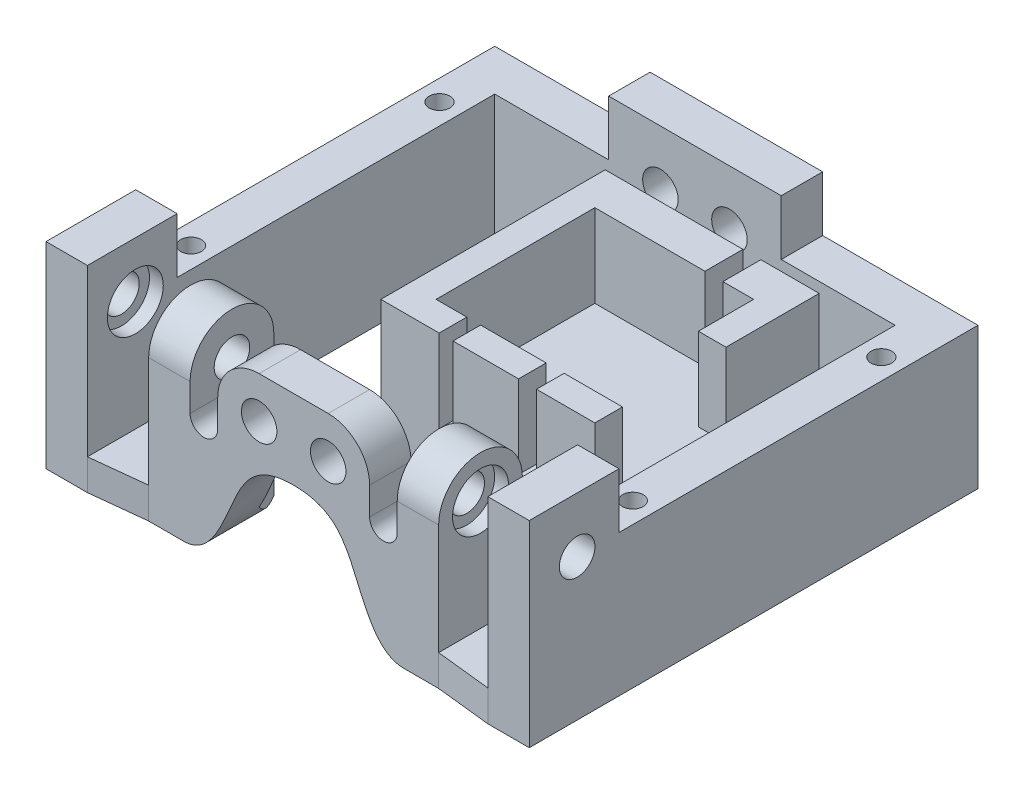
from build123d import *
from build123d.topology import SkipClean

# Parameters (mm, degrees)
BOSS_EXTRUDE1_DEPTH   = 20.5
SKETCH2_W             = 25
SKETCH2_H             = 6
BOSS_EXTRUDE2_DEPTH   = 8
CUT_EXTRUDE1_REACH    = 78.618
SKETCH3_R             = 2.575
SKETCH4_R             = 4.05
CUT_EXTRUDE2_DEPTH    = 2
SKETCH5_W             = 23
SKETCH5_H             = 23
BOSS_EXTRUDE3_DEPTH   = 7
SKETCH16_W            = 31
SKETCH16_H            = 32.5
SKETCH16_W_2          = 23
SKETCH16_H_2          = 23
BOSS_EXTRUDE6_DEPTH   = 19
SKETCH18_W            = 2.6
SKETCH18_H            = 5.5
SKETCH18_H_2          = 4
SKETCH18_W_2          = 2
SKETCH18_W_3          = 4
SKETCH18_H_3          = 15
CUT_EXTRUDE10_DEPTH   = 12
SKETCH8_W             = 6
SKETCH8_H             = 13
BOSS_EXTRUDE4_DEPTH   = 8
CUT_EXTRUDE_X_REACH   = 81.853
SKETCH7_R             = 2.575
SKETCH9_R             = 4.05
CUT_EXTRUDE4_DEPTH    = 2
SKETCH10_W            = 29
SKETCH10_H            = 13
BOSS_EXTRUDE5_DEPTH   = 28.5
SKETCH12_W            = 8
SKETCH12_H            = 13
SKETCH12_W_2          = 15
CUT_EXTRUDE6_DEPTH    = 24
CUT_EXTRUDE7_REACH    = 69.915
SKETCH13_R            = 2.575
CUT_EXTRUDE8_START    = -2
SKETCH14_R            = 4.05
CUT_EXTRUDE8_DEPTH    = 2
CUT_EXTRUDE9_REACH    = 69.915
SKETCH23_W            = 11
SKETCH23_H            = 6
BOSS_EXTRUDE8_DEPTH   = 22
CUT_EXTRUDE12_REACH   = 67.949
SKETCH21_R            = 2.575
SKETCH22_R            = 4.05
CUT_EXTRUDE13_DEPTH   = 2
CUT_EXTRUDE14_REACH   = 78.618
BOSS_EXTRUDE9_REACH   = 77.878
CUT_EXTRUDE15_REACH   = 56.621
CUT_EXTRUDE16_REACH   = 78.618
CUT_EXTRUDE18_REACH   = 55.453
MIRROR1_START         = 19.5
MIRROR1_OUTLINE_R     = 4.05
MIRROR1_DEPTH         = 13
MIRROR1_START_2       = 27.626981996
MIRROR1_2_OUTLINE_R   = 4.05
MIRROR1_2_OUTLINE_R_2 = 2.575
MIRROR1_2_DEPTH       = 4
MIRROR1_START_3       = -11
MIRROR1_3_OUTLINE_W   = 6
MIRROR1_3_OUTLINE_H   = 0.873018004
MIRROR1_3_DEPTH       = 11
MIRROR1_START_4       = -35
MIRROR1_4_OUTLINE_R   = 2.575
MIRROR1_4_DEPTH       = 20
MIRROR1_START_5       = -31
MIRROR1_5_OUTLINE_R   = 4.05
MIRROR1_5_OUTLINE_R_2 = 2.575
MIRROR1_5_DEPTH       = 12
MIRROR1_START_6       = -21
MIRROR1_6_DEPTH       = 6
MIRROR1_START_7       = -19
MIRROR1_7_DEPTH       = 4
MIRROR1_8_DEPTH       = 21
SKETCH33_R            = 1.5
CUT_EXTRUDE19_DEPTH   = 10


with BuildPart() as part:
    # Sketch1 → Boss-Extrude1 (new body)
    with BuildSketch(Plane(origin=(0, 0, 0), x_dir=(1, 0, 0), z_dir=(0, 1, 0))):
        Polygon((-29, 26.5), (-29, -32.5), (-35, -32.5), (-35, 32.5), (35, 32.5), (35, -32.5), (29, -32.5), (29, 26.5), align=None)
    extrude(amount=-BOSS_EXTRUDE1_DEPTH)

    # Sketch2 → Boss-Extrude2 (add)
    with BuildSketch(Plane(origin=(0, 0, 0), x_dir=(-1, 0, 0), z_dir=(0, -1, 0))):
        with Locations((0, 29.5)):
            Rectangle(SKETCH2_W, SKETCH2_H)
    extrude(amount=-BOSS_EXTRUDE2_DEPTH)

    # Sketch3 → Cut-Extrude1 (cut, up to next)
    with BuildSketch(Plane(origin=(0, 0, -32.5), x_dir=(-1, 0, 0), z_dir=(0, 0, -1)), mode=Mode.PRIVATE) as cut_extrude1_sk1:
        with Locations((-5, 0)):
            Circle(SKETCH3_R)
    cut_extrude1_tool1 = extrude(cut_extrude1_sk1.sketch, amount=-CUT_EXTRUDE1_REACH, mode=Mode.PRIVATE) & part.part
    # Sketch3 → Cut-Extrude1 (cut, up to next)
    with BuildSketch(Plane(origin=(0, 0, -32.5), x_dir=(-1, 0, 0), z_dir=(0, 0, -1)), mode=Mode.PRIVATE) as cut_extrude1_sk2:
        with Locations(Location((5, 0, 0), (0, 0, 180))):
            Circle(SKETCH3_R)
    cut_extrude1_tool2 = extrude(cut_extrude1_sk2.sketch, amount=-CUT_EXTRUDE1_REACH, mode=Mode.PRIVATE) & part.part
    add(cut_extrude1_tool1.solids().sort_by_distance((5, 0, -32.5))[0], mode=Mode.SUBTRACT)
    add(cut_extrude1_tool2.solids().sort_by_distance((-5, 0, -32.5))[0], mode=Mode.SUBTRACT)

    # Sketch4 → Cut-Extrude2 (cut)
    with BuildSketch(Plane(origin=(0, 0, -32.5), x_dir=(-1, 0, 0), z_dir=(0, 0, -1))):
        with Locations((-5, 0)):
            Circle(SKETCH4_R)
        with Locations(Location((5, 0, 0), (0, 0, 180))):
            Circle(SKETCH4_R)
    extrude(amount=-CUT_EXTRUDE2_DEPTH, mode=Mode.SUBTRACT)



with BuildPart() as body_2:
    # Sketch5 → Boss-Extrude3 (new body)
    with BuildSketch(Plane(origin=(0, -20.5, 0), x_dir=(1, 0, 0), z_dir=(0, 1, 0))):
        with Locations((2.5, 9.5)):
            Rectangle(SKETCH5_W, SKETCH5_H)
    extrude(amount=BOSS_EXTRUDE3_DEPTH)


with BuildPart() as part_1:
    add(part.part)

    add(body_2.part)  # Boss-Extrude6 merges body 2
    # Sketch16 → Boss-Extrude6 (add)
    with BuildSketch(Plane.XZ.offset(20.5)):
        with Locations((2.5, -10.25)):
            Rectangle(SKETCH16_W, SKETCH16_H)
        with Locations((2.5, -9.5)):
            Rectangle(SKETCH16_W_2, SKETCH16_H_2, mode=Mode.SUBTRACT)
    extrude(amount=-BOSS_EXTRUDE6_DEPTH)

    # Sketch18 → Cut-Extrude10 (cut)
    with BuildSketch(Plane(origin=(0, -1.5, 0), x_dir=(1, 0, 0), z_dir=(0, 1, 0))):
        with Locations((8.25, 23.75)):
            Rectangle(SKETCH18_W, SKETCH18_H)
        with Locations((8.25, -4)):
            Rectangle(SKETCH18_W, SKETCH18_H_2)
        with Locations((-3.55, -4)):
            Rectangle(SKETCH18_W_2, SKETCH18_H_2)
        with Locations((16, 5.5)):
            Rectangle(SKETCH18_W_3, SKETCH18_H_3)
    extrude(amount=-CUT_EXTRUDE10_DEPTH, mode=Mode.SUBTRACT)

    # Sketch8 → Boss-Extrude4 (add)
    with BuildSketch(Plane(origin=(0, 0, 0), x_dir=(1, 0, 0), z_dir=(0, 1, 0))):
        with Locations((32, -26)):
            Rectangle(SKETCH8_W, SKETCH8_H)
    extrude(amount=BOSS_EXTRUDE4_DEPTH)

    # Sketch7 → Cut-Extrude x (cut, up to next)
    with BuildSketch(Plane(origin=(35, 0, 0), x_dir=(0, 0, -1), z_dir=(1, 0, 0)), mode=Mode.PRIVATE) as cut_extrude_x_sk1:
        with Locations((-25.563490998, 0)):
            Circle(SKETCH7_R)
    cut_extrude_x_tool1 = extrude(cut_extrude_x_sk1.sketch, amount=-CUT_EXTRUDE_X_REACH, mode=Mode.PRIVATE) & part_1.part
    add(cut_extrude_x_tool1.solids().sort_by_distance((35, 0, 25.563491))[0], mode=Mode.SUBTRACT)

    # Sketch9 → Cut-Extrude4 (cut)
    with BuildSketch(Plane(origin=(29, 0, 0), x_dir=(0, 0, -1), z_dir=(1, 0, 0))):
        with Locations((-25.563490998, 0)):
            Circle(SKETCH9_R)
    extrude(amount=CUT_EXTRUDE4_DEPTH, mode=Mode.SUBTRACT)

    # Sketch10 → Boss-Extrude5 (add)
    with BuildSketch(Plane.XZ.offset(20.5)):
        with Locations((14.5, 26)):
            Rectangle(SKETCH10_W, SKETCH10_H)
    extrude(amount=-BOSS_EXTRUDE5_DEPTH)

    # Sketch12 → Cut-Extrude6 (cut)
    with BuildSketch(Plane(origin=(0, 8, 0), x_dir=(1, 0, 0), z_dir=(0, 1, 0))):
        with Locations((25, -26)):
            Rectangle(SKETCH12_W, SKETCH12_H)
        with Locations((7.5, -26)):
            Rectangle(SKETCH12_W_2, SKETCH12_H)
    extrude(amount=-CUT_EXTRUDE6_DEPTH, mode=Mode.SUBTRACT)

    # Sketch13 → Cut-Extrude7 (cut, up to next)
    with BuildSketch(Plane(origin=(21, 0, 0), x_dir=(0, 0, -1), z_dir=(1, 0, 0)), mode=Mode.PRIVATE) as cut_extrude7_sk1:
        with Locations((-25.563490998, 0)):
            Circle(SKETCH13_R)
    cut_extrude7_tool1 = extrude(cut_extrude7_sk1.sketch, amount=-CUT_EXTRUDE7_REACH, mode=Mode.PRIVATE) & part_1.part
    add(cut_extrude7_tool1.solids().sort_by_distance((21, 0, 25.563491))[0], mode=Mode.SUBTRACT)

    # Sketch14 → Cut-Extrude8 (cut)
    with BuildSketch(Plane(origin=(21, 0, 0), x_dir=(0, 0, -1), z_dir=(1, 0, 0)).offset(CUT_EXTRUDE8_START)):
        with Locations((-25.563490998, 0)):
            Circle(SKETCH14_R)
    extrude(amount=CUT_EXTRUDE8_DEPTH, mode=Mode.SUBTRACT)

    # Sketch15 → Cut-Extrude9 (cut, up to next)
    with BuildSketch(Plane(origin=(21, 0, 0), x_dir=(0, 0, -1), z_dir=(1, 0, 0)), mode=Mode.PRIVATE) as cut_extrude9_sk1:
        with BuildLine():
            Line((-19.5, 8), (-19.5, 0))
            ThreePointArc((-19.5, 0), (-25.563490998, 6.063490998), (-31.626981996, 0))
            Line((-31.626981996, 0), (-31.626981996, -16))
            Line((-31.626981996, -16), (-32.5, -16))
            Line((-32.5, -16), (-32.5, 8))
            Line((-32.5, 8), (-19.5, 8))
        make_face()
    cut_extrude9_tool1 = extrude(cut_extrude9_sk1.sketch, amount=-CUT_EXTRUDE9_REACH, mode=Mode.PRIVATE) & part_1.part
    add(cut_extrude9_tool1.solids().sort_by_distance((21, 4, 19.772947))[0], mode=Mode.SUBTRACT)

    # Sketch23 → Boss-Extrude8 (add)
    with BuildSketch(Plane(origin=(0, -16, 0), x_dir=(1, 0, 0), z_dir=(0, 1, 0))):
        with Locations((5.5, -28.626981996)):
            Rectangle(SKETCH23_W, SKETCH23_H)
    extrude(amount=BOSS_EXTRUDE8_DEPTH)

    # Sketch21 → Cut-Extrude12 (cut, up to next)
    with BuildSketch(Plane(origin=(0, 0, 19.5), x_dir=(-1, 0, 0), z_dir=(0, 0, -1)), mode=Mode.PRIVATE) as cut_extrude12_sk1:
        with Locations((-5, 0)):
            Circle(SKETCH21_R)
    cut_extrude12_tool1 = extrude(cut_extrude12_sk1.sketch, amount=-CUT_EXTRUDE12_REACH, mode=Mode.PRIVATE) & part_1.part
    add(cut_extrude12_tool1.solids().sort_by_distance((5, 0, 19.5))[0], mode=Mode.SUBTRACT)

    # Sketch22 → Cut-Extrude13 (cut)
    with BuildSketch(Plane(origin=(0, 0, 25.626981996), x_dir=(-1, 0, 0), z_dir=(0, 0, -1))):
        with Locations((-5, 0)):
            Circle(SKETCH22_R)
    extrude(amount=-CUT_EXTRUDE13_DEPTH, mode=Mode.SUBTRACT)

    # Sketch25 → Cut-Extrude14 (cut, up to next)
    with BuildSketch(Plane.XY.offset(32.5), mode=Mode.PRIVATE) as cut_extrude14_sk1:
        with BuildLine():
            Line((5, 6), (11, 6))
            Line((11, 6), (11, 0))
            ThreePointArc((11, 0), (9.242640687, 4.242640687), (5, 6))
        make_face()
    cut_extrude14_tool1 = extrude(cut_extrude14_sk1.sketch, amount=-CUT_EXTRUDE14_REACH, mode=Mode.PRIVATE) & part_1.part
    add(cut_extrude14_tool1.solids().sort_by_distance((9.659792, 4.659792, 32.5))[0], mode=Mode.SUBTRACT)

    # Boss-Extrude9: up to this face of the body (flat: up to its plane)
    boss_extrude9_end = Plane(part_1.part.faces().sort_by_distance((15.983443709, -13.905629139, 19.5))[0])
    # Sketch26 → Boss-Extrude9 (add, up to the picked face)
    with BuildSketch(Plane.XY.offset(31.626981996), mode=Mode.PRIVATE) as boss_extrude9_sk1:
        with BuildLine():
            Line((11, -4), (11, -16))
            Line((11, -16), (15, -16))
            Line((15, -16), (15, -4))
            ThreePointArc((15, -4), (13, -6), (11, -4))
        make_face()
    boss_extrude9_tool1 = split(extrude(boss_extrude9_sk1.sketch, amount=-BOSS_EXTRUDE9_REACH, mode=Mode.PRIVATE), bisect_by=boss_extrude9_end, keep=Keep.BOTH, mode=Mode.PRIVATE)
    add(boss_extrude9_tool1.solids().sort_by(Axis((13, -10.775845, 31.626982), (0, 0, -1)))[0])

    # Sketch27 → Cut-Extrude15 (cut, up to next)
    with BuildSketch(Plane(origin=(0, 6, 0), x_dir=(1, 0, 0), z_dir=(0, 1, 0)), mode=Mode.PRIVATE) as cut_extrude15_sk1:
        Polygon((15, -19.5), (11, -25.626981996), (0, -25.626981996), (0, -19.5), align=None)
    cut_extrude15_tool1 = extrude(cut_extrude15_sk1.sketch, amount=-CUT_EXTRUDE15_REACH, mode=Mode.PRIVATE) & part_1.part
    add(cut_extrude15_tool1.solids().sort_by_distance((6.551282, 6, 22.406389))[0], mode=Mode.SUBTRACT)

    # Sketch28 → Cut-Extrude16 (cut, up to next)
    with BuildSketch(Plane.XY.offset(32.5), mode=Mode.PRIVATE) as cut_extrude16_sk1:
        with BuildLine():
            Line((0, -5.5), (0, -20.5))
            Line((0, -20.5), (15.968399563, -20.5))
            add(Edge.make_bspline(
                [(0, -5.5), (5.784672224, -5.5), (8.919068478, -11.920884454), (12.308392799, -20.5), (15.968399563, -20.5)],
                knots=[0, 0, 0, 0, 0.502636185, 1, 1, 1, 1], degree=3))
        make_face()
    cut_extrude16_tool1 = extrude(cut_extrude16_sk1.sketch, amount=-CUT_EXTRUDE16_REACH, mode=Mode.PRIVATE) & part_1.part
    add(cut_extrude16_tool1.solids().sort_by_distance((4.970773, -14.293365, 32.5))[0], mode=Mode.SUBTRACT)

    # Sketch32 → Cut-Extrude18 (cut, up to next)
    with BuildSketch(Plane(origin=(0, -16, 0), x_dir=(1, 0, 0), z_dir=(0, 1, 0)), mode=Mode.PRIVATE) as cut_extrude18_sk1:
        Polygon((10.593097258, -31.626981996), (21, -31.626981996), (29, -32.5), (10.593097258, -32.5), align=None)
    cut_extrude18_tool1 = extrude(cut_extrude18_sk1.sketch, amount=-CUT_EXTRUDE18_REACH, mode=Mode.PRIVATE) & part_1.part
    add(cut_extrude18_tool1.solids().sort_by_distance((17.981645, -16, 32.103889))[0], mode=Mode.SUBTRACT)

    # Mirror1: read off the stored shape, not the designer's step
    # Mirror1 outline → Mirror1 (add)
    # profile 1 of 2: a face of its own
    with BuildSketch(Plane.XY.offset(MIRROR1_START)):
        with BuildLine():
            Line((-29, -20.5), (-15.968399563, -20.5))
            add(Edge.make_bspline(
                [(-15.968399563, -20.5), (-12.308392799, -20.5), (-8.919068478, -11.920884454), (-5.784672224, -5.5), (0, -5.5)],
                knots=[0, 0, 0, 0, 0.497363815, 1, 1, 1, 1], degree=3))
            Line((0, -5.5), (0, 6))
            Line((0, 6), (-5, 6))
            ThreePointArc((-5, 6), (-9.242640687, 4.242640687), (-11, 0))
            Line((-11, 0), (-11, -4))
            ThreePointArc((-11, -4), (-13, -6), (-15, -4))
            Line((-15, -4), (-15, 0))
            Line((-15, 0), (-19, 0))
            Line((-19, 0), (-21, 0))
            Line((-21, 0), (-21, -16))
            Line((-21, -16), (-29, -16))
            Line((-29, -16), (-29, -20.5))
        make_face()
        with Locations((-5, 0)):
            Circle(MIRROR1_OUTLINE_R, mode=Mode.SUBTRACT)
    # profile 2 of 2: a face of its own
    with BuildSketch(Plane.XY.offset(MIRROR1_START)):
        Polygon((-35, 8), (-35, 0), (-31, 0), (-29, 0), (-29, 8), align=None)
    extrude(amount=MIRROR1_DEPTH)

    # Mirror1 2 outline → Mirror1 2 (add)
    with BuildSketch(Plane.XY.offset(MIRROR1_START_2)):
        with Locations((-5, 0)):
            Circle(MIRROR1_2_OUTLINE_R)
        with Locations((-5, 0)):
            Circle(MIRROR1_2_OUTLINE_R_2, mode=Mode.SUBTRACT)
    extrude(amount=MIRROR1_2_DEPTH)

    # Mirror1 3 outline → Mirror1 3 (cut)
    with BuildSketch(Plane.YZ.offset(MIRROR1_START_3)):
        with BuildLine():
            Line((6, 25.626981996), (-4.049502302, 25.626981996))
            ThreePointArc((-4.049502302, 25.626981996), (-2.886142628, 22.722244664), (0, 21.513490998))
            Line((0, 21.513490998), (0, 19.5))
            Line((0, 19.5), (6, 19.5))
            Line((6, 19.5), (6, 25.626981996))
        make_face()
        with Locations((3, 32.063490998)):
            Rectangle(MIRROR1_3_OUTLINE_W, MIRROR1_3_OUTLINE_H)
    extrude(amount=MIRROR1_3_DEPTH, mode=Mode.SUBTRACT)

    # Mirror1 4 outline → Mirror1 4 (cut)
    with BuildSketch(Plane.YZ.offset(MIRROR1_START_4)):
        with Locations((0, 25.563490998)):
            Circle(MIRROR1_4_OUTLINE_R)
    extrude(amount=MIRROR1_4_DEPTH, mode=Mode.SUBTRACT)

    # Mirror1 5 outline → Mirror1 5 (cut)
    with BuildSketch(Plane.YZ.offset(MIRROR1_START_5)):
        with Locations((0, 25.563490998)):
            Circle(MIRROR1_5_OUTLINE_R)
        with Locations((0, 25.563490998)):
            Circle(MIRROR1_5_OUTLINE_R_2, mode=Mode.SUBTRACT)
    extrude(amount=MIRROR1_5_DEPTH, mode=Mode.SUBTRACT)

    # Mirror1 6 outline → Mirror1 6 (add)
    with BuildSketch(Plane.YZ.offset(MIRROR1_START_6)):
        with BuildLine():
            ThreePointArc((0, 19.5), (6.063490998, 25.563490998), (0, 31.626981996))
            Line((0, 31.626981996), (0, 29.613490998))
            ThreePointArc((0, 29.613490998), (4.05, 25.563490998), (0, 21.513490998))
            Line((0, 21.513490998), (0, 19.5))
        make_face()
    extrude(amount=MIRROR1_6_DEPTH)

    # Mirror1 7 outline → Mirror1 7 (add)
    with SkipClean():  # the faces are left unmerged after this step: merging them gives an invalid solid
        with BuildSketch(Plane.YZ.offset(MIRROR1_START_7)):
            with BuildLine():
                Line((0, 29.613490998), (0, 28.138490998))
                ThreePointArc((0, 28.138490998), (2.575, 25.563490998), (0, 22.988490998))
                Line((0, 22.988490998), (0, 21.513490998))
                ThreePointArc((0, 21.513490998), (4.05, 25.563490998), (0, 29.613490998))
            make_face()
        extrude(amount=MIRROR1_7_DEPTH)
    add(part_1.part.scale(1), mode=Mode.REPLACE)  # the faces are merged on a copy

    # Mirror1 8 outline → Mirror1 8 (cut)
    with BuildSketch(Plane(origin=(0, 0, 0), x_dir=(1, 0, 0), z_dir=(0, 1, 0)).offset(MIRROR1_START_6)):
        Polygon((0, -19.5), (-15, -19.5), (-11, -25.626981996), (0, -25.626981996), align=None)
        Polygon((0, -31.626981996), (-21, -31.626981996), (-29, -32.5), (0, -32.5), align=None)
    extrude(amount=MIRROR1_8_DEPTH, mode=Mode.SUBTRACT)

    # Sketch33 → Cut-Extrude19 (cut)
    with BuildSketch(Plane(origin=(0, 0, 0), x_dir=(1, 0, 0), z_dir=(0, 1, 0))):
        with Locations(Location((-32, -14.5, 0), (0, 0, 270))):
            Circle(SKETCH33_R)
        with Locations(Location((-32, 21.5, 0), (0, 0, 270))):
            Circle(SKETCH33_R)
    cut_extrude19 = extrude(amount=-CUT_EXTRUDE19_DEPTH, mode=Mode.SUBTRACT)

    # Mirror2: Cut-Extrude19 across plane
    add(cut_extrude19.mirror(Plane(origin=(0, 0, 0), x_dir=(0, 0, 1), z_dir=(1, 0, 0))), mode=Mode.SUBTRACT)


solid = part_1.part
